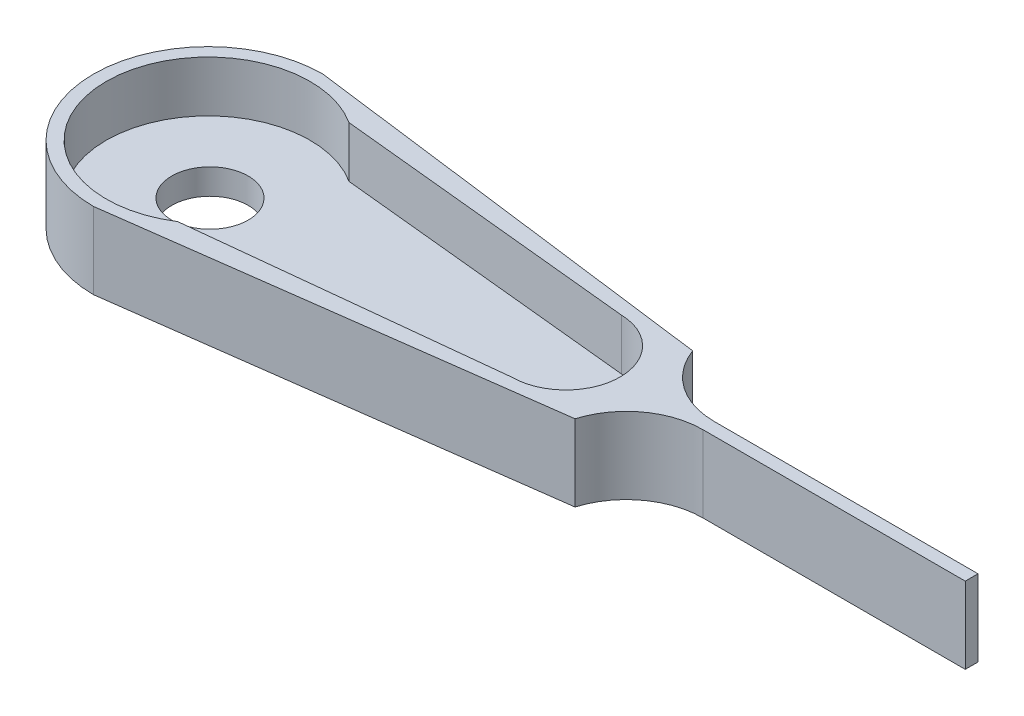
from build123d import *

# Parameters (mm, degrees)
SKETCH2_R           = 1.5
BOSS_EXTRUDE1_DEPTH = 1
BOSS_EXTRUDE2_DEPTH = 3
FILLET1_R           = 3
FILLET2_R           = 3


with BuildPart() as part:
    # Sketch2 → Boss-Extrude1 (new body)
    with BuildSketch(Plane(origin=(0, 0, 0), x_dir=(1, 0, 0), z_dir=(0, 1, 0))):
        with BuildLine():
            Line((-12.939762178, 2.094266176), (-24.821781773, 3.29179515))
            ThreePointArc((-24.821781773, 3.29179515), (-30.987291256, -0.071668068), (-24.821747911, -3.435069212))
            Line((-24.821747911, -3.435069212), (-12.987160246, -2.166440487))
            ThreePointArc((-12.987160246, -2.166440487), (-10.8566751, -0.059524017), (-12.939762178, 2.094266176))
        make_face()
        with Locations(Location((-26.987114413, 0, 0), (0, 0, 270))):
            Circle(SKETCH2_R, mode=Mode.SUBTRACT)
    extrude(amount=BOSS_EXTRUDE1_DEPTH)

    # Sketch2<3> → Boss-Extrude2 (add)
    with BuildSketch(Plane(origin=(0, 0, 0), x_dir=(1, 0, 0), z_dir=(0, 1, 0))):
        with BuildLine():
            Line((-10.322349305, -2.339041202), (-10.322728968, -0.2))
            Line((-10.322728968, -0.2), (2.851540312, -0.2))
            Line((2.851540312, -0.2), (2.851540312, 0.3))
            Line((2.851540312, 0.3), (-10.322728968, 0.3))
            Line((-10.322728968, 0.3), (-10.322728968, 2.279037645))
            Line((-10.322728968, 2.279037645), (-26.987114411, 4.428185187))
            ThreePointArc((-26.987114411, 4.428185187), (-31.48694753, -0.071647931), (-26.987114411, -4.57148105))
            Line((-26.987114411, -4.57148105), (-10.322349305, -2.339041202))
        make_face()
        with BuildLine():
            ThreePointArc((-12.939762178, 2.094266176), (-10.8566751, -0.059524017), (-12.987160246, -2.166440487))
            Line((-12.987160246, -2.166440487), (-24.821747911, -3.435069212))
            ThreePointArc((-24.821747911, -3.435069212), (-30.987291256, -0.071668068), (-24.821781773, 3.29179515))
            Line((-24.821781773, 3.29179515), (-12.939762178, 2.094266176))
        make_face(mode=Mode.SUBTRACT)
    extrude(amount=BOSS_EXTRUDE2_DEPTH)

    # Fillet1
    # the kernel refuses this fillet: 3 mm, written as the material it adds along each edge
    with BuildSketch(Plane(origin=(-10.322728968, 0, -0.3), x_dir=(1, 0, 0), z_dir=(0, 1, 0))) as fillet1_piece_1:
        with BuildLine():
            CenterArc((2.820928193, 3), FILLET1_R, 199.896419226, 70.103580774)
            Line((0, 1.979037645), (-0.056418564, 1.958618398))
            ThreePointArc((-0.056418564, 1.958618398), (-0.06, 0.989518822), (-0.06, 0))
            Line((-0.06, 0), (0, -0.06))
            Line((0, -0.06), (2.820928193, -0.06))
            Line((2.820928193, -0.06), (2.820928193, 0))
        make_face()
    extrude(amount=3)

    # Fillet2
    # the kernel refuses this fillet: 3 mm, written as the material it adds along each edge
    with BuildSketch(Plane(origin=(-10.322728968, 0, 0.2), x_dir=(1, 0, 0), z_dir=(0, 1, 0))) as fillet2_piece_1:
        with BuildLine():
            CenterArc((2.874183753, -3), FILLET2_R, 90, 73.322386102)
            Line((0.000379663, -2.139041202), (-0.057096419, -2.121822026))
            ThreePointArc((-0.057096419, -2.121822026), (-0.059810168, -1.069531251), (-0.059999999, -1.065e-05))
            Line((-0.059999999, -1.065e-05), (0, 0.06))
            Line((0, 0.06), (2.874183753, 0.06))
            Line((2.874183753, 0.06), (2.874183753, 0))
        make_face()
    extrude(amount=3)


solid = part.part
